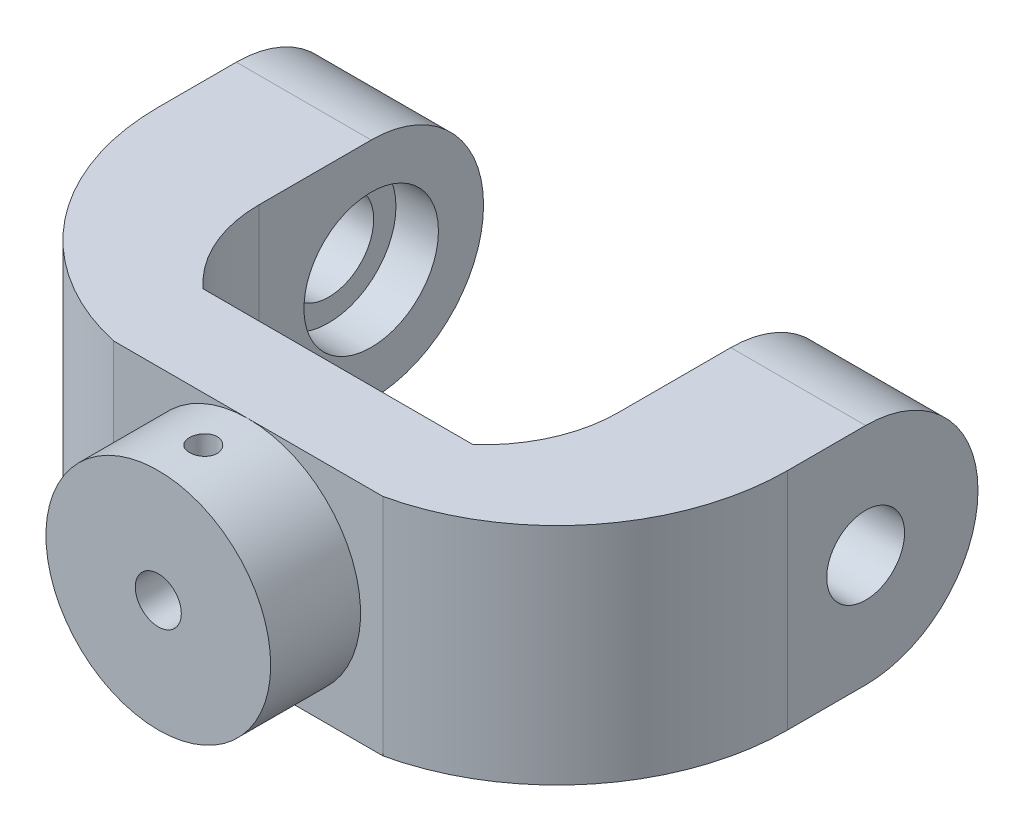
from build123d import *

# Parameters (mm, degrees)
SKETCH1_R               = 15.875
SKETCH1_R_2             = 3.25
BOSS_EXTRUDE1_DEPTH     = 12.7
BOSS_EXTRUDE2_START     = -12.7
SKETCH1_3_W             = 38.1
SKETCH1_3_H             = 31.75
SKETCH1_3_R             = 3.25
BOSS_EXTRUDE2_DEPTH     = 12.7
CUT_EXTRUDE1_REACH      = 41.144
CUT_EXTRUDE1_END_RADIUS = 3.25
BOSS_EXTRUDE3_DEPTH     = 31.75
FILLET1_R               = 15.875
SKETCH8_R               = 6.35
CUT_EXTRUDE3_DEPTH      = 76.282979766
SKETCH8_3_R             = 9.5
SKETCH8_3_R_2           = 6.35
CUT_EXTRUDE4_DEPTH      = 6
SKETCH9_R               = 6.35
SKETCH9_R_2             = 5.5
BOSS_EXTRUDE4_DEPTH     = 13.05
SKETCH10_R              = 1.95
CUT_EXTRUDE5_DEPTH      = 10.16
CUT_EXTRUDE6_REACH      = 102.653
CUT_EXTRUDE6_END_RADIUS = 5.5


with BuildPart() as part:
    # Sketch1 → Boss-Extrude1 (new body)
    with BuildSketch(Plane.XY):
        Circle(SKETCH1_R)
        Circle(SKETCH1_R_2, mode=Mode.SUBTRACT)
    extrude(amount=BOSS_EXTRUDE1_DEPTH)

    # Sketch1<3> → Boss-Extrude2 (add)
    with BuildSketch(Plane.XY.offset(BOSS_EXTRUDE2_START)):
        Rectangle(SKETCH1_3_W, SKETCH1_3_H)
        Circle(SKETCH1_3_R, mode=Mode.SUBTRACT)
    extrude(amount=BOSS_EXTRUDE2_DEPTH)

    # Cut-Extrude1: up to this cylinder (the profile starts outside it)
    cut_extrude1_end = Plane(origin=(0, 0, 6.35), z_dir=(0, 0, -1)) * Cylinder(CUT_EXTRUDE1_END_RADIUS, 89.788, mode=Mode.PRIVATE)
    # Sketch4 → Cut-Extrude1 (cut, up to the surface)
    with BuildSketch(Plane(origin=(0, 15.875, 0), x_dir=(1, 0, 0), z_dir=(0, 1, 0)), mode=Mode.PRIVATE) as cut_extrude1_sk1:
        with BuildLine():
            ThreePointArc((1.95, -6.35), (1.378858223, -4.971141777), (0, -4.4))
            Line((0, -4.4), (0, -8.3))
            ThreePointArc((0, -8.3), (1.378858223, -7.728858223), (1.95, -6.35))
        make_face()
    cut_extrude1_tool1 = extrude(cut_extrude1_sk1.sketch, amount=-CUT_EXTRUDE1_REACH, mode=Mode.PRIVATE) - cut_extrude1_end
    add(cut_extrude1_tool1.solids().sort_by_distance((0.827606, 15.875, 6.35))[0], mode=Mode.SUBTRACT)
    # Sketch4 → Cut-Extrude1 (cut, up to the surface)
    with BuildSketch(Plane(origin=(0, 15.875, 0), x_dir=(1, 0, 0), z_dir=(0, 1, 0)), mode=Mode.PRIVATE) as cut_extrude1_sk2:
        with BuildLine():
            Line((0, -8.3), (0, -4.4))
            ThreePointArc((0, -4.4), (-1.95, -6.35), (0, -8.3))
        make_face()
    cut_extrude1_tool2 = extrude(cut_extrude1_sk2.sketch, amount=-CUT_EXTRUDE1_REACH, mode=Mode.PRIVATE) - cut_extrude1_end
    add(cut_extrude1_tool2.solids().sort_by_distance((-0.827606, 15.875, 6.35))[0], mode=Mode.SUBTRACT)
    # Sketch4 → Cut-Extrude1 (cut, up to the surface)
    with BuildSketch(Plane(origin=(0, 15.875, 0), x_dir=(1, 0, 0), z_dir=(0, 1, 0)), mode=Mode.PRIVATE) as cut_extrude1_sk3:
        with BuildLine():
            ThreePointArc((1.95, -6.35), (1.378858223, -4.971141777), (0, -4.4))
            Line((0, -4.4), (0, -8.3))
            ThreePointArc((0, -8.3), (1.378858223, -7.728858223), (1.95, -6.35))
        make_face()
    cut_extrude1_tool3 = extrude(cut_extrude1_sk3.sketch, amount=-CUT_EXTRUDE1_REACH, mode=Mode.PRIVATE) - cut_extrude1_end
    add(cut_extrude1_tool3.solids().sort_by_distance((0.827606, 15.875, 6.35))[0], mode=Mode.SUBTRACT)
    # Sketch4 → Cut-Extrude1 (cut, up to the surface)
    with BuildSketch(Plane(origin=(0, 15.875, 0), x_dir=(1, 0, 0), z_dir=(0, 1, 0)), mode=Mode.PRIVATE) as cut_extrude1_sk4:
        with BuildLine():
            Line((0, -8.3), (0, -4.4))
            ThreePointArc((0, -4.4), (-1.95, -6.35), (0, -8.3))
        make_face()
    cut_extrude1_tool4 = extrude(cut_extrude1_sk4.sketch, amount=-CUT_EXTRUDE1_REACH, mode=Mode.PRIVATE) - cut_extrude1_end
    add(cut_extrude1_tool4.solids().sort_by_distance((-0.827606, 15.875, 6.35))[0], mode=Mode.SUBTRACT)

    # Sketch7 → Boss-Extrude3 (add)
    with BuildSketch(Plane(origin=(0, 15.875, 0), x_dir=(1, 0, 0), z_dir=(0, 1, 0))):
        with BuildLine():
            ThreePointArc((-19.05, 12.7), (-23.740191201, 19.121901724), (-25.4, 26.899031657))
            Line((-25.4, 26.899031657), (-25.4, 58.649031657))
            Line((-25.4, 58.649031657), (-44.45, 58.649031657))
            Line((-44.45, 58.649031657), (-44.45, 31.75))
            ThreePointArc((-44.45, 31.75), (-37.318649317, 11.420080546), (-19.05, 0))
            Line((-19.05, 0), (-19.05, 12.7))
        make_face()
    extrude(amount=-BOSS_EXTRUDE3_DEPTH)

    # Fillet1
    fillet1_edges = [part.edges().sort_by_distance(p)[0] for p in [
        (-34.925, -15.875, -58.649031657),
        (-34.925, 15.875, -58.649031657),
    ]]
    fillet(fillet1_edges, radius=FILLET1_R - 0.0001)  # a hair under: the kernel refuses the full size

    # Sketch8 → Cut-Extrude3 (cut, through all)
    with BuildSketch(Plane(origin=(-25.4, 0, 0), x_dir=(0, 0, -1), z_dir=(1, 0, 0))):
        with Locations((42.774031657, 0)):
            Circle(SKETCH8_R)
    extrude(amount=-CUT_EXTRUDE3_DEPTH, mode=Mode.SUBTRACT)

    # Sketch8<3> → Cut-Extrude4 (cut)
    with BuildSketch(Plane(origin=(-25.4, 0, 0), x_dir=(0, 0, -1), z_dir=(1, 0, 0))):
        with Locations((42.774031657, 0)):
            Circle(SKETCH8_3_R)
        with Locations((42.774031657, 0)):
            Circle(SKETCH8_3_R_2, mode=Mode.SUBTRACT)
    extrude(amount=-CUT_EXTRUDE4_DEPTH, mode=Mode.SUBTRACT)

    # Mirror1: part across plane


with BuildPart() as part_1:
    add(part.part)
    add(part.part.mirror(Plane(origin=(0, 0, 0), x_dir=(0, 0, 1), z_dir=(1, 0, 0))))

    # Sketch9 → Boss-Extrude4 (add)
    with BuildSketch(Plane(origin=(44.45, 0, 0), x_dir=(0, 0, -1), z_dir=(1, 0, 0))):
        with Locations((42.774031657, 0)):
            Circle(SKETCH9_R)
        with Locations((42.774031657, 0)):
            Circle(SKETCH9_R_2, mode=Mode.SUBTRACT)
    extrude(amount=-BOSS_EXTRUDE4_DEPTH)

    # Sketch10 → Cut-Extrude5 (cut)
    with BuildSketch(Plane.ZY.offset(44.45)):
        with Locations((-42.774031657, 12.7)):
            Circle(SKETCH10_R)
        with Locations((-42.774031657, -12.7)):
            Circle(SKETCH10_R)
    extrude(amount=-CUT_EXTRUDE5_DEPTH, mode=Mode.SUBTRACT)

    # Cut-Extrude6: up to this cylinder (the profile starts outside it)
    cut_extrude6_end = Plane(origin=(35.381138, 0, -42.774031657), z_dir=(1, 0, 0)) * Cylinder(CUT_EXTRUDE6_END_RADIUS, 217.306, mode=Mode.PRIVATE)
    # Sketch11 → Cut-Extrude6 (cut, up to the surface)
    with BuildSketch(Plane.XY.offset(-76.2), mode=Mode.PRIVATE) as cut_extrude6_sk1:
        with BuildLine():
            ThreePointArc((33.431138122, 0), (35.381138122, -1.95), (37.331138122, 0))
            Line((37.331138122, 0), (33.431138122, 0))
        make_face()
    cut_extrude6_tool1 = extrude(cut_extrude6_sk1.sketch, amount=CUT_EXTRUDE6_REACH, mode=Mode.PRIVATE) - cut_extrude6_end
    add(cut_extrude6_tool1.solids().sort_by_distance((35.381138, -0.827606, -76.2))[0], mode=Mode.SUBTRACT)
    # Sketch11 → Cut-Extrude6 (cut, up to the surface)
    with BuildSketch(Plane.XY.offset(-76.2), mode=Mode.PRIVATE) as cut_extrude6_sk2:
        with BuildLine():
            Line((33.431138122, 0), (37.331138122, 0))
            ThreePointArc((37.331138122, 0), (35.381138122, 1.95), (33.431138122, 0))
        make_face()
    cut_extrude6_tool2 = extrude(cut_extrude6_sk2.sketch, amount=CUT_EXTRUDE6_REACH, mode=Mode.PRIVATE) - cut_extrude6_end
    add(cut_extrude6_tool2.solids().sort_by_distance((35.381138, 0.827606, -76.2))[0], mode=Mode.SUBTRACT)
    # Sketch11 → Cut-Extrude6 (cut, up to the surface)
    with BuildSketch(Plane.XY.offset(-76.2), mode=Mode.PRIVATE) as cut_extrude6_sk3:
        with BuildLine():
            ThreePointArc((33.431138122, 0), (35.381138122, -1.95), (37.331138122, 0))
            Line((37.331138122, 0), (33.431138122, 0))
        make_face()
    cut_extrude6_tool3 = extrude(cut_extrude6_sk3.sketch, amount=CUT_EXTRUDE6_REACH, mode=Mode.PRIVATE) - cut_extrude6_end
    add(cut_extrude6_tool3.solids().sort_by_distance((35.381138, -0.827606, -76.2))[0], mode=Mode.SUBTRACT)
    # Sketch11 → Cut-Extrude6 (cut, up to the surface)
    with BuildSketch(Plane.XY.offset(-76.2), mode=Mode.PRIVATE) as cut_extrude6_sk4:
        with BuildLine():
            Line((33.431138122, 0), (37.331138122, 0))
            ThreePointArc((37.331138122, 0), (35.381138122, 1.95), (33.431138122, 0))
        make_face()
    cut_extrude6_tool4 = extrude(cut_extrude6_sk4.sketch, amount=CUT_EXTRUDE6_REACH, mode=Mode.PRIVATE) - cut_extrude6_end
    add(cut_extrude6_tool4.solids().sort_by_distance((35.381138, 0.827606, -76.2))[0], mode=Mode.SUBTRACT)


solid = part_1.part
